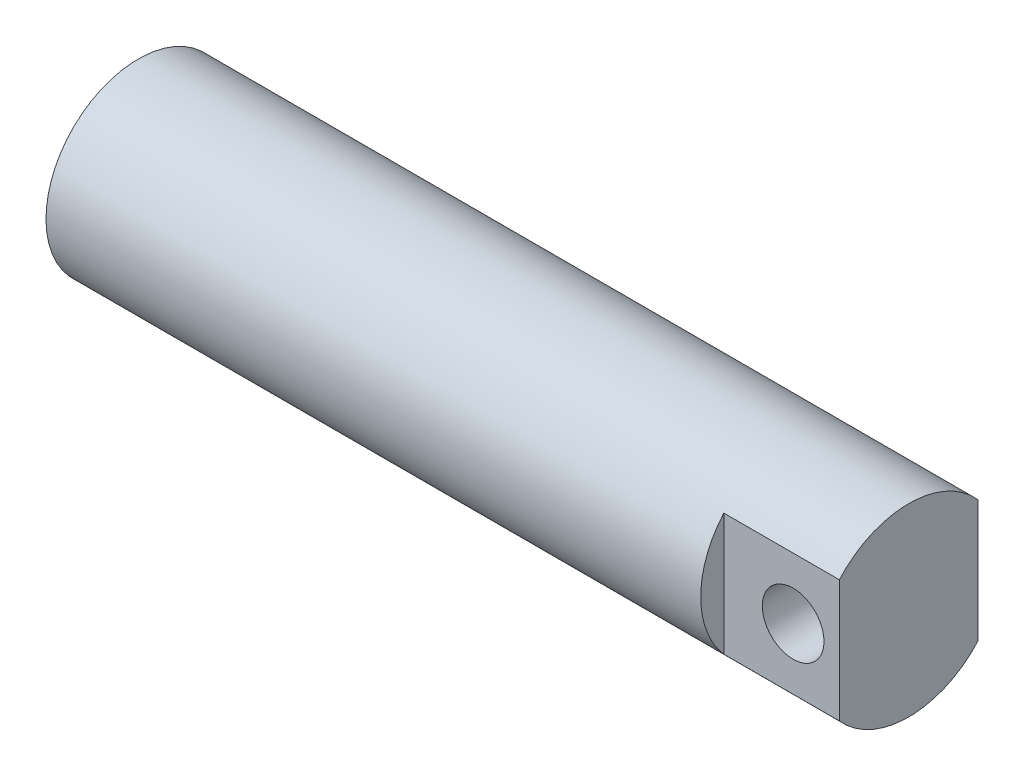
from build123d import *

# Parameters (mm, degrees)
SKETCH2_R           = 38.1
BOSS_EXTRUDE1_DEPTH = 158.75
CUT_EXTRUDE1_DEPTH  = 47.625
SKETCH4_R           = 12.7
CUT_EXTRUDE2_DEPTH  = 177.348314778


with BuildPart() as part:
    # Sketch2 → Boss-Extrude1 (new, symmetric)
    with BuildSketch(Plane(origin=(0, 0, 0), x_dir=(0, 0, -1), z_dir=(1, 0, 0))):
        Circle(SKETCH2_R)
    extrude(amount=BOSS_EXTRUDE1_DEPTH, both=True)

    # Sketch3 → Cut-Extrude1 (cut)
    with BuildSketch(Plane(origin=(158.75, 0, 0), x_dir=(0, 0, -1), z_dir=(1, 0, 0))):
        with BuildLine():
            Line((-28.575, 25.200781238), (-28.575, -25.200781238))
            ThreePointArc((-28.575, -25.200781238), (-38.1, 0), (-28.575, 25.200781238))
        make_face()
        with BuildLine():
            Line((28.575, 25.200781238), (28.575, -25.200781238))
            ThreePointArc((28.575, -25.200781238), (38.1, 0), (28.575, 25.200781238))
        make_face()
    extrude(amount=-CUT_EXTRUDE1_DEPTH, mode=Mode.SUBTRACT)

    # Sketch4 → Cut-Extrude2 (cut, through all)
    with BuildSketch(Plane.XY.offset(28.575)):
        with Locations((139.7, 0)):
            Circle(SKETCH4_R)
    extrude(amount=-CUT_EXTRUDE2_DEPTH, mode=Mode.SUBTRACT)


solid = part.part
